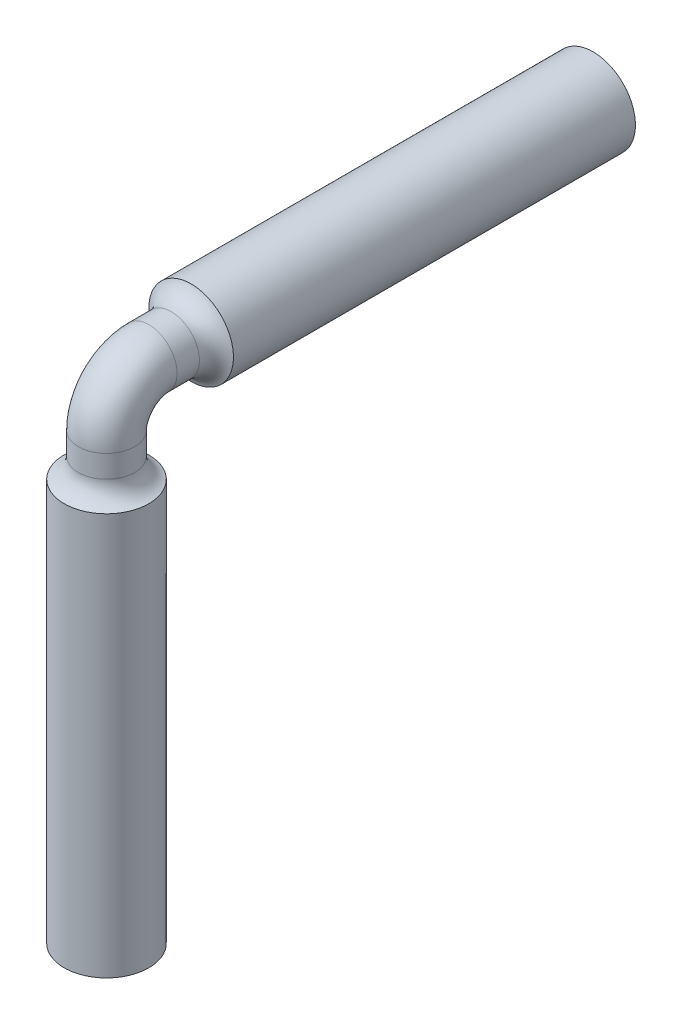
from build123d import *

# Parameters (mm, degrees)
SKETCH_1_R      = 2
SKETCH_3_R      = 3
EXTRUDE_1_DEPTH = 28.5
SKETCH_4_R      = 3
EXTRUDE_2_DEPTH = 28.5
FILLET_1_R      = 1.5


with BuildPart() as part:
    # 스윕1: sweep along a path in 스케치2
    with BuildLine(Plane(origin=(0, 0, 0), x_dir=(0, 0, -1), z_dir=(1, 0, 0))) as sweep_1_path:
        Line((0, 0), (0, 31.5))
        ThreePointArc((0, 31.5), (0.878679656, 33.621320344), (3, 34.5))
        Line((3, 34.5), (34.5, 34.5))
    # 스케치1 → 스윕1 (sweep)
    with BuildSketch(Plane(origin=(0, 0, 0), x_dir=(1, 0, 0), z_dir=(0, 1, 0))):
        Circle(SKETCH_1_R)
    sweep(path=sweep_1_path.line)

    # 스케치3 → 보스-돌출1 (add)
    with BuildSketch(Plane.XZ):
        with Locations(Location((0, 0, 0), (0, 0, 270))):
            Circle(SKETCH_3_R)
    extrude(amount=-EXTRUDE_1_DEPTH)

    # 스케치4 → 보스-돌출2 (add)
    with BuildSketch(Plane(origin=(0, 0, -34.5), x_dir=(-1, 0, 0), z_dir=(0, 0, -1))):
        with Locations((0, 34.5)):
            Circle(SKETCH_4_R)
    extrude(amount=-EXTRUDE_2_DEPTH)

    # 필렛1
    # the kernel refuses this fillet: 1.5 mm, written as the material it adds along each edge
    with BuildSketch(Plane(origin=(0, 28.5, 0), x_dir=(1, 0, 0), z_dir=(0, 0, 1))) as fillet_1_piece_1:
        with BuildLine():
            CenterArc((3.5, 1.414213562), FILLET_1_R, 180, 70.528779366)
            Line((2, 1.414213562), (1.97, 1.414213562))
            Line((1.97, 1.414213562), (1.97, 0))
            Line((1.97, 0), (2, -0.03))
            ThreePointArc((2, -0.03), (2.5, -0.03), (2.99, -0.028284271))
            Line((2.99, -0.028284271), (3, 0))
        make_face()
    revolve(axis=Axis((0, 28.5, 0), (0, 1, 0)))
    with BuildSketch(Plane(origin=(0, 34.5, -6), x_dir=(1, 0, 0), z_dir=(0, 1, 0))) as fillet_1_piece_2:
        with BuildLine():
            CenterArc((3.5, -1.414213562), FILLET_1_R, 109.471220634, 70.528779366)
            Line((3, 0), (2.99, 0.028284271))
            ThreePointArc((2.99, 0.028284271), (2.5, 0.03), (2, 0.03))
            Line((2, 0.03), (1.97, 0))
            Line((1.97, 0), (1.97, -1.414213562))
            Line((1.97, -1.414213562), (2, -1.414213562))
        make_face()
    revolve(axis=Axis((0, 34.5, -6), (0, 0, -1)))


solid = part.part
